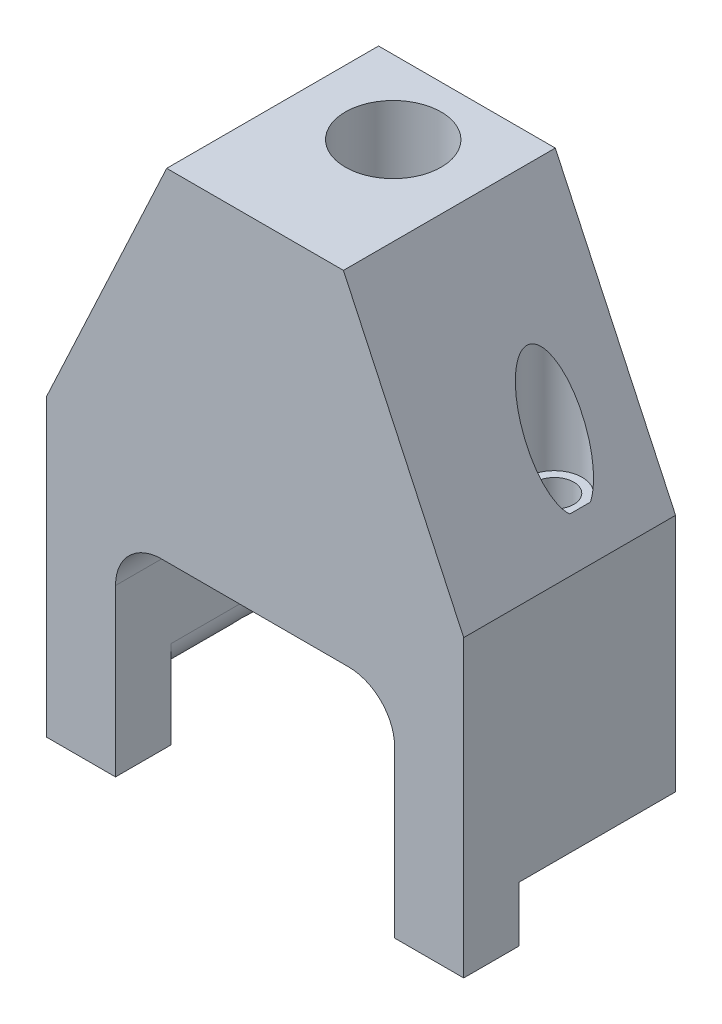
from build123d import *

# Parameters (mm, degrees)
BOSS_EXTRUDE1_DEPTH      = 11.5
CUT_EXTRUDE1_DEPTH       = 35.906446396
CUT_EXTRUDE1_DEPTH_BACK  = 35.906446396
SKETCH3_R                = 1.05
BOSS_EXTRUDE2_DEPTH      = 3
BOSS_EXTRUDE2_DEPTH_BACK = 11.5
SKETCH4_W                = 3.75
SKETCH4_H                = 3
CUT_EXTRUDE2_DEPTH       = 38.275461128
CUT_EXTRUDE2_DEPTH_BACK  = 38.275461128
SKETCH5_R                = 1.25
CHAMFER1_SIZE            = 6.528307214
CHAMFER1_SIZE_2          = 14
CHAMFER2_SIZE            = 6.528307214
CHAMFER2_SIZE_2          = 14
SKETCH6_R                = 2.6
CUT_EXTRUDE3_DEPTH       = 5
SKETCH7_R                = 1.5
CUT_EXTRUDE4_DEPTH       = 12


with BuildPart() as part:
    # Sketch1 → Boss-Extrude1 (new body)
    with BuildSketch(Plane.XY):
        with BuildLine():
            Line((16.91, 0), (18.9, 0))
            Line((18.9, 0), (18.9, 27))
            Line((18.9, 27), (-3.75, 27))
            Line((-3.75, 27), (-3.75, 0))
            Line((-3.75, 0), (-1.76, 0))
            ThreePointArc((-1.76, 0), (-0.515492065, 0.515492065), (0, 1.76))
            Line((0, 1.76), (0, 6))
            ThreePointArc((0, 6), (0.732233047, 7.767766953), (2.5, 8.5))
            Line((2.5, 8.5), (12.65, 8.5))
            ThreePointArc((12.65, 8.5), (14.417766953, 7.767766953), (15.15, 6))
            Line((15.15, 6), (15.15, 1.76))
            ThreePointArc((15.15, 1.76), (15.665492065, 0.515492065), (16.91, 0))
        make_face()
    extrude(amount=-BOSS_EXTRUDE1_DEPTH)

    # Sketch3 → Cut-Extrude1 (cut, two sides: drawn at the far end of the back side and taken through both)
    with BuildSketch(Plane(origin=(0, 27, 0), x_dir=(1, 0, 0), z_dir=(0, 1, 0)).offset(-CUT_EXTRUDE1_DEPTH_BACK)):
        with Locations(Location((-1.425, 7.25, 0), (0, 0, 251.394661296))):
            Circle(SKETCH3_R)
        with Locations(Location((16.575, 7.25, 0), (0, 0, 288.605338704))):
            Circle(SKETCH3_R)
    extrude(amount=CUT_EXTRUDE1_DEPTH + CUT_EXTRUDE1_DEPTH_BACK, mode=Mode.SUBTRACT)

    # Sketch4 → Boss-Extrude2 (add, two sides: drawn at the far end of the back side and taken through both)
    with BuildSketch(Plane.XZ.offset(-BOSS_EXTRUDE2_DEPTH_BACK)):
        with Locations((17.025, -1.5)):
            Rectangle(SKETCH4_W, SKETCH4_H)
        with Locations((-1.875, -1.5)):
            Rectangle(SKETCH4_W, SKETCH4_H)
    extrude(amount=BOSS_EXTRUDE2_DEPTH + BOSS_EXTRUDE2_DEPTH_BACK)

    # Sketch5 → Cut-Extrude2 (cut, two sides: drawn at the far end of the back side and taken through both)
    with BuildSketch(Plane(origin=(0, 27, 0), x_dir=(1, 0, 0), z_dir=(0, 1, 0)).offset(-CUT_EXTRUDE2_DEPTH_BACK)):
        with Locations(Location((7.575, 7.5, 0), (0, 0, 90))):
            Circle(SKETCH5_R)
    extrude(amount=CUT_EXTRUDE2_DEPTH + CUT_EXTRUDE2_DEPTH_BACK, mode=Mode.SUBTRACT)

    # Chamfer1
    # the kernel refuses this chamfer: 14, 6.528307214 mm, written as the material it takes off along each edge
    with BuildSketch(Plane(origin=(-3.75, 27, 36.2736566), x_dir=(0.9971975577536776, 0.07481330637059945, 0), z_dir=(0, 0, -1))) as chamfer1_piece_1:
        Polygon((CHAMFER1_SIZE * 0.99719755778, CHAMFER1_SIZE * 0.0748133063725), (-CHAMFER1_SIZE_2 * 0.0748133063706, CHAMFER1_SIZE_2 * 0.997197557754), (0, 0), align=None)
    extrude(amount=84.0473132, mode=Mode.SUBTRACT)

    # Chamfer2
    # the kernel refuses this chamfer: 14, 6.528307214 mm, written as the material it takes off along each edge
    with BuildSketch(Plane(origin=(18.9, 27, 36.2736566), x_dir=(-0.9971975577536776, 0.07481330637059945, 0), z_dir=(0, 0, -1))) as chamfer2_piece_1:
        Polygon((CHAMFER2_SIZE * 0.99719755778, -CHAMFER2_SIZE * 0.0748133063725), (-CHAMFER2_SIZE_2 * 0.0748133063706, -CHAMFER2_SIZE_2 * 0.997197557754), (0, 0), align=None)
    extrude(amount=84.0473132, mode=Mode.SUBTRACT)

    # Sketch6 → Cut-Extrude3 (cut)
    with BuildSketch(Plane(origin=(0, 27, 0), x_dir=(1, 0, 0), z_dir=(0, 1, 0))):
        with Locations(Location((7.575, 7.5, 0), (0, 0, 270))):
            Circle(SKETCH6_R)
    extrude(amount=-CUT_EXTRUDE3_DEPTH, mode=Mode.SUBTRACT)

    # Sketch7 → Cut-Extrude4 (cut)
    with BuildSketch(Plane(origin=(0, 27, 0), x_dir=(1, 0, 0), z_dir=(0, 1, 0))):
        with Locations((-1.425, 7.25)):
            Circle(SKETCH7_R)
        with Locations((16.575, 7.25)):
            Circle(SKETCH7_R)
    extrude(amount=-CUT_EXTRUDE4_DEPTH, mode=Mode.SUBTRACT)


solid = part.part
